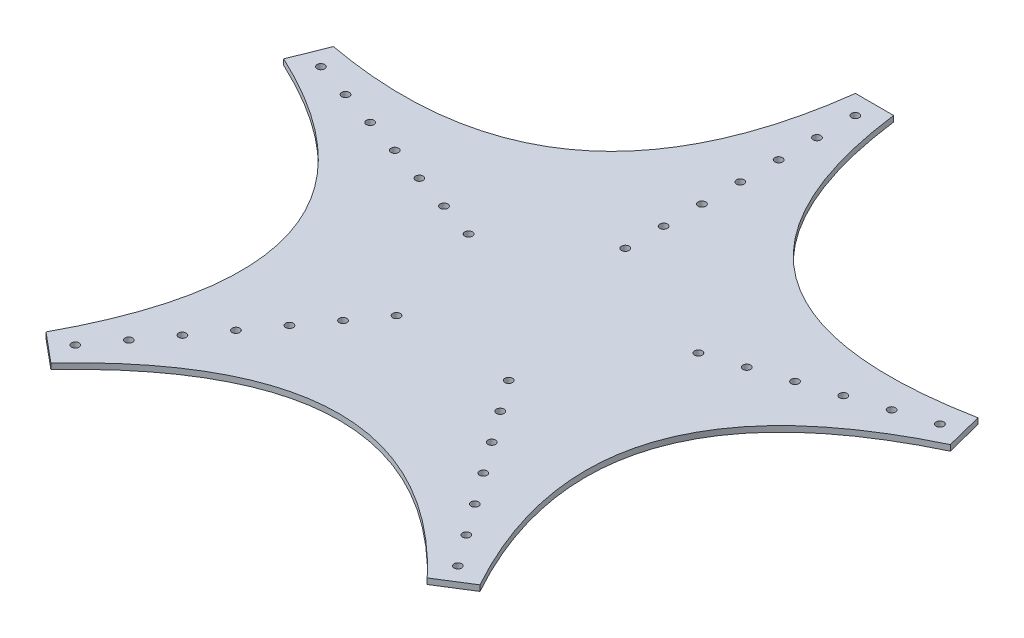
from build123d import *

# Parameters (mm, degrees)
BOSS_EXTRUDE1_DEPTH = 3.81
SKETCH1_R           = 2.54
CUT_EXTRUDE2_DEPTH  = 3.81


with BuildPart() as part:
    # Sketch2 → Boss-Extrude1 (new body)
    with BuildSketch(Plane(origin=(0, 0, 0), x_dir=(1, 0, 0), z_dir=(0, 1, 0))):
        with BuildLine():
            Line((-213.487003797, 82.719702671), (-222.951127572, 59.087642398))
            add(Edge.make_bspline(
                [(-222.951127572, 59.087642398), (-58.216601102, -17.936864293), (-144.642224503, -177.47641221)],
                knots=[0, 0, 0, 1, 1, 1], degree=2))
            Line((-144.642224503, -177.47641221), (-125.09137467, -193.780037034))
            add(Edge.make_bspline(
                [(-125.09137467, -193.780037034), (-0.930947428, -60.910073727), (124.093192846, -192.406157618)],
                knots=[0, 0, 0, 1, 1, 1], degree=2))
            Line((124.093192846, -192.406157618), (145.640406327, -178.850291626))
            add(Edge.make_bspline(
                [(145.640406327, -178.850291626), (57.64124395, -19.707631528), (221.336035454, 58.562867157)],
                knots=[0, 0, 0, 1, 1, 1], degree=2))
            Line((221.336035454, 58.562867157), (215.102095915, 83.244477912))
            add(Edge.make_bspline(
                [(215.102095915, 83.244477912), (35.990508407, 48.698207316), (12.7, 229.477457482)],
                knots=[0, 0, 0, 1, 1, 1], degree=2))
            Line((12.7, 229.477457482), (-12.7, 229.477457482))
            add(Edge.make_bspline(
                [(-12.7, 229.477457482), (-35.70709029, 49.753304003), (-213.487003797, 82.719702671)],
                knots=[0, 0, 0, 1, 1, 1], degree=2))
        make_face()
    extrude(amount=BOSS_EXTRUDE1_DEPTH)

    # Sketch1 → Cut-Extrude2 (cut)
    with BuildSketch(Plane(origin=(0, 0, 0), x_dir=(1, 0, 0), z_dir=(0, 1, 0))):
        with Locations((0, 63.524373819)):
            Circle(SKETCH1_R)
        with Locations((0, 89.046242914)):
            Circle(SKETCH1_R)
        with Locations((0, 114.568112009)):
            Circle(SKETCH1_R)
        with Locations((0, 140.089981103)):
            Circle(SKETCH1_R)
        with Locations((0, 165.611850198)):
            Circle(SKETCH1_R)
        with Locations((0, 191.133719293)):
            Circle(SKETCH1_R)
        with Locations((0, 216.655588388)):
            Circle(SKETCH1_R)
        with Locations((84.688009575, 27.516802346)):
            Circle(SKETCH1_R)
        with Locations((108.960749485, 35.403493624)):
            Circle(SKETCH1_R)
        with Locations((133.233489396, 43.290184903)):
            Circle(SKETCH1_R)
        with Locations((157.506229307, 51.176876181)):
            Circle(SKETCH1_R)
        with Locations((181.778969217, 59.06356746)):
            Circle(SKETCH1_R)
        with Locations((206.051709128, 66.950258738)):
            Circle(SKETCH1_R)
        with Locations((37.338690092, -51.392297977)):
            Circle(SKETCH1_R)
        with Locations((52.340068357, -72.039923802)):
            Circle(SKETCH1_R)
        with Locations((67.341446622, -92.687549628)):
            Circle(SKETCH1_R)
        with Locations((82.342824886, -113.335175454)):
            Circle(SKETCH1_R)
        with Locations((97.344203151, -133.98280128)):
            Circle(SKETCH1_R)
        with Locations((112.345581416, -154.630427106)):
            Circle(SKETCH1_R)
        with Locations((127.346959681, -175.278052932)):
            Circle(SKETCH1_R)
        with Locations((-37.338690092, -51.392297977)):
            Circle(SKETCH1_R)
        with Locations((-52.340068357, -72.039923802)):
            Circle(SKETCH1_R)
        with Locations((-67.341446622, -92.687549628)):
            Circle(SKETCH1_R)
        with Locations((-82.342824886, -113.335175454)):
            Circle(SKETCH1_R)
        with Locations((-97.344203151, -133.98280128)):
            Circle(SKETCH1_R)
        with Locations((-112.345581416, -154.630427106)):
            Circle(SKETCH1_R)
        with Locations((-127.346959681, -175.278052932)):
            Circle(SKETCH1_R)
        with Locations((-60.415269664, 19.630111067)):
            Circle(SKETCH1_R)
        with Locations((-84.688009575, 27.516802346)):
            Circle(SKETCH1_R)
        with Locations((-108.960749485, 35.403493624)):
            Circle(SKETCH1_R)
        with Locations((-133.233489396, 43.290184903)):
            Circle(SKETCH1_R)
        with Locations((-157.506229307, 51.176876181)):
            Circle(SKETCH1_R)
        with Locations((-181.778969217, 59.06356746)):
            Circle(SKETCH1_R)
        with Locations((-206.051709128, 66.950258738)):
            Circle(SKETCH1_R)
    extrude(amount=CUT_EXTRUDE2_DEPTH, mode=Mode.SUBTRACT)


solid = part.part
